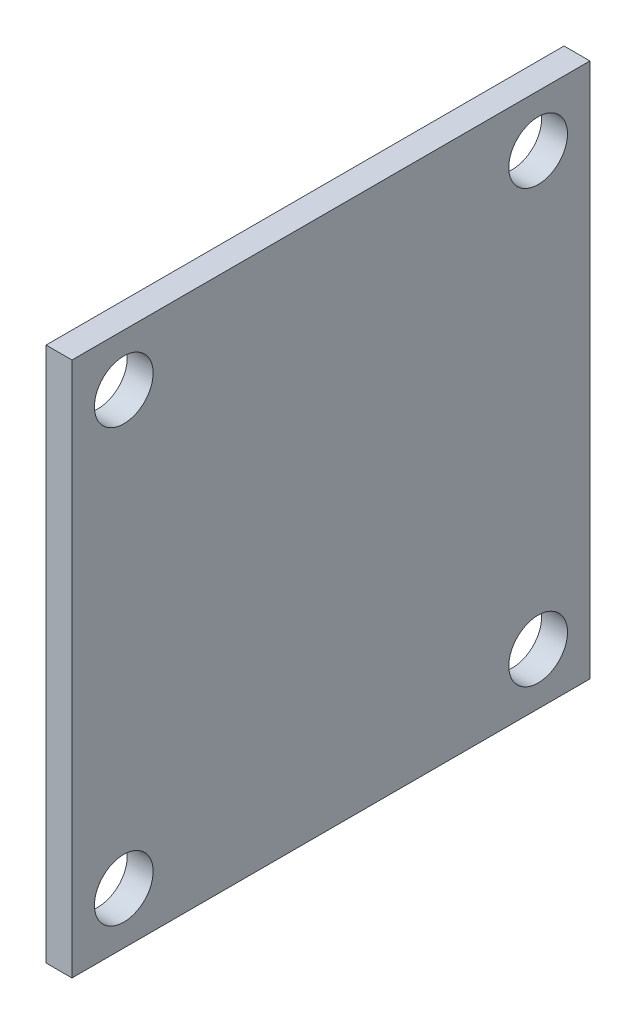
from build123d import *

# Parameters (mm, degrees)
SKETCH_1_W             = 30
SKETCH_1_H             = 31
SM_BASE_FLANGE_1_DEPTH = 1.5
HOLE_WIZARD_M3_1_D     = 3.4
HOLE_WIZARD_M3_1_DEPTH = 20
HOLE_WIZARD_M3_1_TIP   = 1.021463052


# Sheet-metal steps are written as plain solids
with BuildPart() as part:
    # Sketch 1 → 基体-法兰1 (new body)
    with BuildSketch(Plane(origin=(0, 0, 0), x_dir=(0, 0, -1), z_dir=(1, 0, 0))):
        Rectangle(SKETCH_1_W, SKETCH_1_H)
    extrude(amount=-SM_BASE_FLANGE_1_DEPTH)

    # M3 间隙孔1
    with Locations(Plane(origin=(0, 0, 0), x_dir=(0, 0, -1), z_dir=(1, 0, 0))):
        with Locations((-12, 12.5), (12, 12.5), (12, -12.5), (-12, -12.5)):
            Hole(HOLE_WIZARD_M3_1_D / 2, depth=HOLE_WIZARD_M3_1_DEPTH)
            with Locations((0, 0, -(HOLE_WIZARD_M3_1_DEPTH + HOLE_WIZARD_M3_1_TIP / 2))):  # 118° drill point
                Cone(0, HOLE_WIZARD_M3_1_D / 2, HOLE_WIZARD_M3_1_TIP, mode=Mode.SUBTRACT)


solid = part.part
